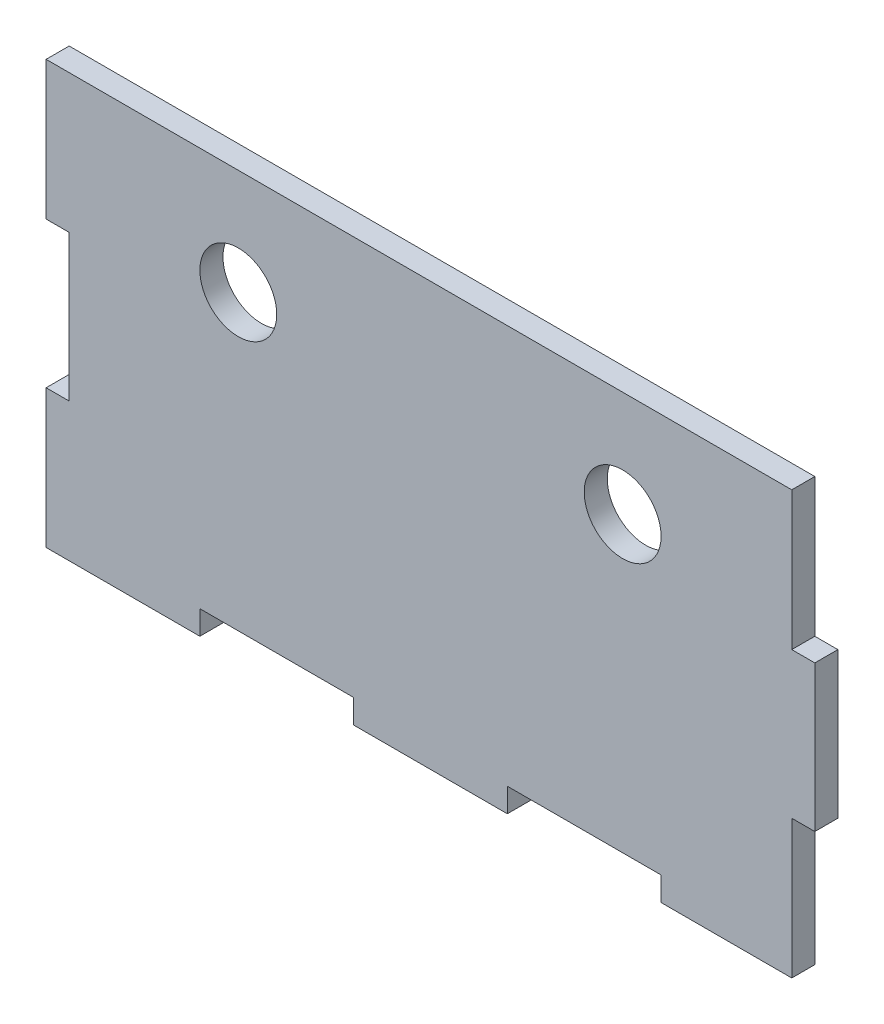
from build123d import *

# Parameters (mm, degrees)
SKETCH1_R           = 5
BOSS_EXTRUDE1_DEPTH = 3


with BuildPart() as part:
    # Sketch1 → Boss-Extrude1 (new body)
    with BuildSketch(Plane.XY):
        Polygon((-50, -9.5), (-50, -27.5), (-30, -27.5), (-30, -24.393503037), (-10, -24.393503037), (-10, -27.5), (10, -27.5), (10, -24.393503037), (30, -24.393503037), (30, -27.5), (47, -27.5), (47, -9.5), (50, -9.5), (50, 9.5), (47, 9.5), (47, 27.5), (-50, 27.5), (-50, 9.5), (-47, 9.5), (-47, -9.5), align=None)
        with Locations((-25, 13.75)):
            Circle(SKETCH1_R, mode=Mode.SUBTRACT)
        with Locations((25, 13.75)):
            Circle(SKETCH1_R, mode=Mode.SUBTRACT)
    extrude(amount=BOSS_EXTRUDE1_DEPTH)


solid = part.part
